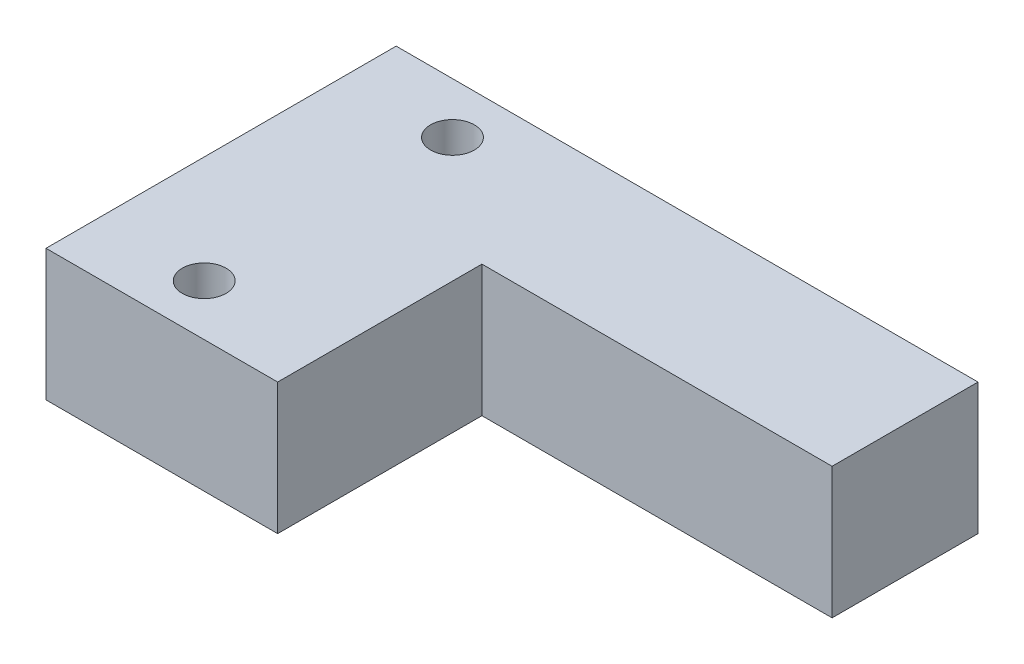
from build123d import *

# Parameters (mm, degrees)
SKETCH1_W           = 39.878
SKETCH1_H           = 24
BOSS_EXTRUDE1_DEPTH = 9
SKETCH2_W           = 24
SKETCH2_H           = 14
CUT_EXTRUDE1_DEPTH  = 25.951226844
SKETCH4_R           = 1.5
CUT_EXTRUDE2_DEPTH  = 25.951226844


with BuildPart() as part:
    # Sketch1 → Boss-Extrude1 (new body)
    with BuildSketch(Plane(origin=(0, 0, 0), x_dir=(1, 0, 0), z_dir=(0, 1, 0))):
        Rectangle(SKETCH1_W, SKETCH1_H)
    extrude(amount=BOSS_EXTRUDE1_DEPTH)

    # Sketch2 → Cut-Extrude1 (cut, through all)
    with BuildSketch(Plane(origin=(0, 9, 0), x_dir=(1, 0, 0), z_dir=(0, 1, 0))):
        with Locations((7.939, -5)):
            Rectangle(SKETCH2_W, SKETCH2_H)
    extrude(amount=-CUT_EXTRUDE1_DEPTH, mode=Mode.SUBTRACT)

    # Sketch4 → Cut-Extrude2 (cut, through all)
    with BuildSketch(Plane(origin=(0, 9, 0), x_dir=(1, 0, 0), z_dir=(0, 1, 0))):
        with Locations((-12.589, -8.509)):
            Circle(SKETCH4_R)
        with Locations((-12.589, 8.509)):
            Circle(SKETCH4_R)
    extrude(amount=-CUT_EXTRUDE2_DEPTH, mode=Mode.SUBTRACT)


solid = part.part
